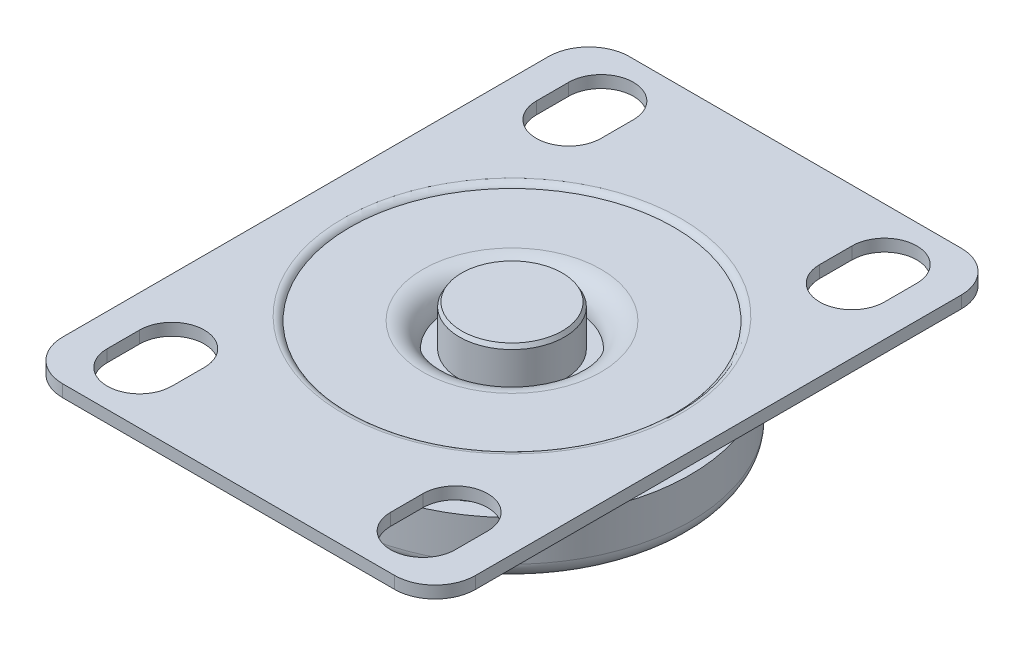
from build123d import *

# Parameters (mm, degrees)
BOSS_EXTRUDE1_DEPTH = 1.5
CUT_EXTRUDE1_DEPTH  = 2
SKETCH3_R           = 4
CUT_EXTRUDE2_DEPTH  = 2
SKETCH4_R           = 20
CUT_EXTRUDE3_DEPTH  = 0.5
FILLET1_R           = 1
SKETCH5_R           = 22
BOSS_EXTRUDE2_DEPTH = 3
SKETCH6_R           = 6.5
BOSS_EXTRUDE3_DEPTH = 2
CHAMFER1_SIZE       = 0.5
CHAMFER1_SIZE2      = 0.288675135
SKETCH7_R           = 7.5
BOSS_EXTRUDE4_DEPTH = 1.5
SKETCH8_R           = 22
BOSS_EXTRUDE5_DEPTH = 7
FILLET3_R           = 2
CUT_EXTRUDE4_START  = -3
SKETCH9_R           = 8
SKETCH9_R_2         = 6.5
CUT_EXTRUDE4_DEPTH  = 3
FILLET4_R           = 3


# Some blends are built 0.0001 mm under size
with BuildPart() as part:
    # Sketch1 → Boss-Extrude1 (new body)
    with BuildSketch(Plane(origin=(0, 0, 0), x_dir=(1, 0, 0), z_dir=(0, 1, 0))):
        with BuildLine():
            Line((-20.5, -35), (20.5, -35))
            ThreePointArc((20.5, -35), (24.035533906, -33.535533906), (25.5, -30))
            Line((25.5, -30), (25.5, 30))
            ThreePointArc((25.5, 30), (24.035533906, 33.535533906), (20.5, 35))
            Line((20.5, 35), (-20.5, 35))
            ThreePointArc((-20.5, 35), (-24.035533906, 33.535533906), (-25.5, 30))
            Line((-25.5, 30), (-25.5, -30))
            ThreePointArc((-25.5, -30), (-24.035533906, -33.535533906), (-20.5, -35))
        make_face()
    extrude(amount=BOSS_EXTRUDE1_DEPTH)

    # Sketch2 → Cut-Extrude1 (cut)
    with BuildSketch(Plane(origin=(0, 1.5, 0), x_dir=(1, 0, 0), z_dir=(0, 1, 0))):
        with BuildLine():
            Line((-21.5, 24.5), (-21.5, 28.5))
            ThreePointArc((-21.5, 28.5), (-17.5, 32.5), (-13.5, 28.5))
            Line((-13.5, 28.5), (-13.5, 24.5))
            ThreePointArc((-13.5, 24.5), (-17.5, 20.5), (-21.5, 24.5))
        make_face()
        with BuildLine():
            Line((13.5, 24.5), (13.5, 28.5))
            ThreePointArc((13.5, 28.5), (17.5, 32.5), (21.5, 28.5))
            Line((21.5, 28.5), (21.5, 24.5))
            ThreePointArc((21.5, 24.5), (17.5, 20.5), (13.5, 24.5))
        make_face()
    cut_extrude1 = extrude(amount=-CUT_EXTRUDE1_DEPTH, mode=Mode.SUBTRACT)

    # Mirror1: Cut-Extrude1 across plane
    add(cut_extrude1.mirror(Plane.XY), mode=Mode.SUBTRACT)

    # Sketch3 → Cut-Extrude2 (cut)
    with BuildSketch(Plane(origin=(0, 1.5, 0), x_dir=(1, 0, 0), z_dir=(0, 1, 0))):
        with Locations(Location((0, 0, 0), (0, 0, 270))):
            Circle(SKETCH3_R)
    extrude(amount=-CUT_EXTRUDE2_DEPTH, mode=Mode.SUBTRACT)

    # Sketch4 → Cut-Extrude3 (cut)
    with BuildSketch(Plane(origin=(0, 1.5, 0), x_dir=(1, 0, 0), z_dir=(0, 1, 0))):
        with Locations(Location((0, 0, 0), (0, 0, 270))):
            Circle(SKETCH4_R)
    extrude(amount=-CUT_EXTRUDE3_DEPTH, mode=Mode.SUBTRACT)

    # Fillet1
    # the kernel refuses this fillet: 1 mm, written as the material it takes off along each edge
    with BuildSketch(Plane(origin=(0, 1.5, 0), x_dir=(0, 0, 1), z_dir=(-1, 0, 0))) as fillet1_piece_1:
        with BuildLine():
            CenterArc((20.866025404, -1), FILLET1_R, 90, 60)
            Line((20, -0.5), (19.982679492, -0.49))
            ThreePointArc((19.982679492, -0.49), (19.98, -0.25), (19.98, 0))
            Line((19.98, 0), (20, 0.02))
            Line((20, 0.02), (20.866025404, 0.02))
            Line((20.866025404, 0.02), (20.866025404, 0))
        make_face()
    revolve(axis=Axis((0, 1.5, 0), (0, 1, 0)), mode=Mode.SUBTRACT)

    # Sketch5 → Boss-Extrude2 (add)
    with BuildSketch(Plane.XZ):
        with Locations(Location((0, 0, 0), (0, 0, 270))):
            Circle(SKETCH5_R)
    extrude(amount=BOSS_EXTRUDE2_DEPTH)

    # Sketch6 → Boss-Extrude3 (add)
    with BuildSketch(Plane(origin=(0, 1, 0), x_dir=(1, 0, 0), z_dir=(0, 1, 0))):
        with Locations(Location((0, 0, 0), (0, 0, 270))):
            Circle(SKETCH6_R)
    extrude(amount=BOSS_EXTRUDE3_DEPTH)

    # Chamfer1
    chamfer1_edges = [part.edges().sort_by_distance(p)[0] for p in [
        (0, 3, -6.5),
    ]]
    chamfer1_side = [part.faces().sort_by_distance(p)[0] for p in [
        (0, 2, -6.5),
    ]]
    chamfer(chamfer1_edges, length=CHAMFER1_SIZE, length2=CHAMFER1_SIZE2, reference=chamfer1_side[0])

    # Sketch7 → Boss-Extrude4 (add)
    with BuildSketch(Plane.XZ.offset(3)):
        with Locations(Location((0, 0, 0), (0, 0, 270))):
            Circle(SKETCH7_R)
    extrude(amount=BOSS_EXTRUDE4_DEPTH)

    # Sketch8 → Boss-Extrude5 (add)
    with BuildSketch(Plane.XZ.offset(4.5)):
        with Locations(Location((0, 0, 0), (0, 0, 270))):
            Circle(SKETCH8_R)
    extrude(amount=BOSS_EXTRUDE5_DEPTH)

    # Fillet3
    fillet3_edges = [part.edges().sort_by_distance(p)[0] for p in [
        (0, -11.5, 22),
    ]]
    fillet(fillet3_edges, radius=FILLET3_R)

    # Sketch9 → Cut-Extrude4 (cut)
    with BuildSketch(Plane(origin=(0, 1, 0), x_dir=(1, 0, 0), z_dir=(0, 1, 0)).offset(CUT_EXTRUDE4_START)):
        with Locations(Location((0, 0, 0), (0, 0, 270))):
            Circle(SKETCH9_R)
        with Locations(Location((0, 0, 0), (0, 0, 270))):
            Circle(SKETCH9_R_2, mode=Mode.SUBTRACT)
    extrude(amount=CUT_EXTRUDE4_DEPTH, mode=Mode.SUBTRACT)

    # Fillet4
    fillet4_edges = [part.edges().sort_by_distance(p)[0] for p in [
        (0, 1, -8),
    ]]
    fillet(fillet4_edges, radius=FILLET4_R - 0.0001)  # a hair under: the kernel refuses the full size


solid = part.part
